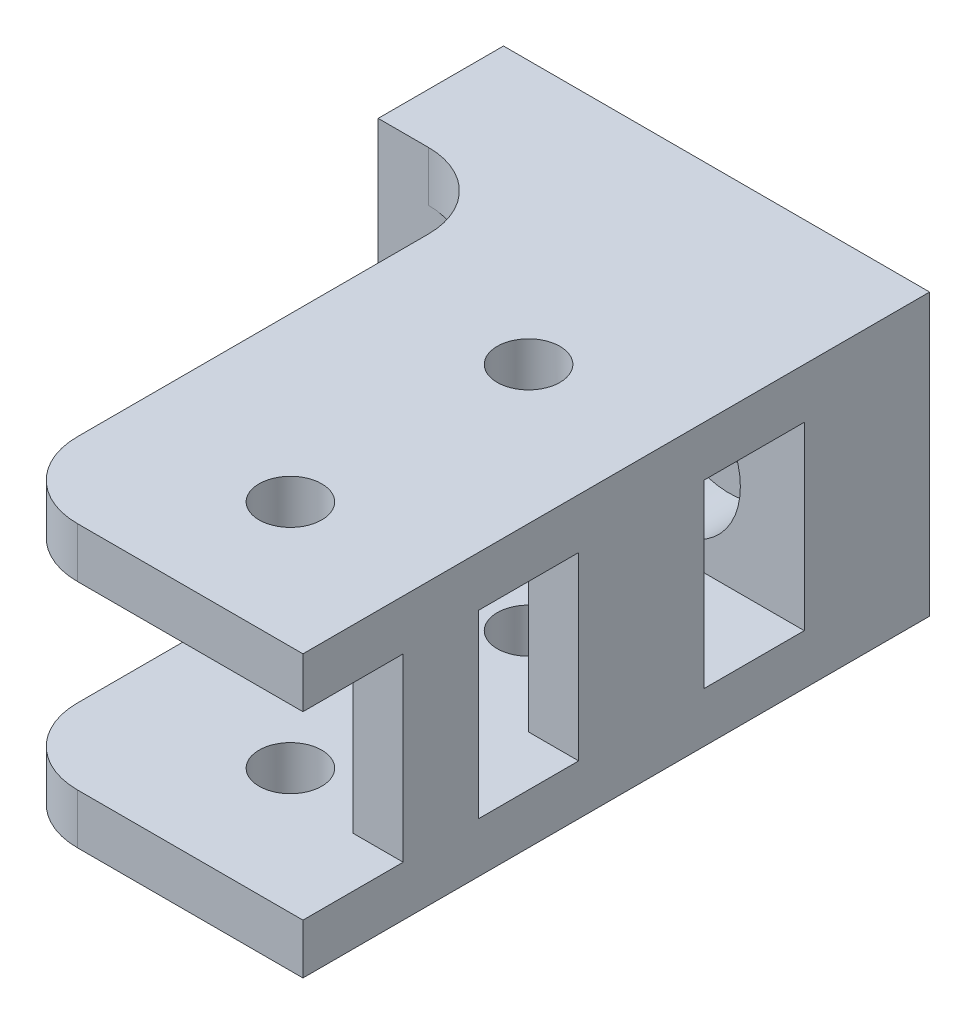
from build123d import *

# Parameters (mm, degrees)
ESQUISSE1_W             = 16.999166609
ESQUISSE1_H             = 11.2
ESQUISSE1_R             = 1.75
BOSS_EXTRU_1_DEPTH      = 5
ESQUISSE2_W             = 2
ESQUISSE2_H             = 7.2
BOSS_EXTRU_2_DEPTH      = 20
ESQUISSE3_W             = 4
ESQUISSE3_H             = 7.2
ENL_V_MAT_EXTRU_1_DEPTH = 20
ESQUISSE4_R             = 1.25
ESQUISSE4_W             = 4.999166609
ESQUISSE4_H             = 20
ENL_V_MAT_EXTRU_2_DEPTH = 20
ESQUISSE5_R             = 2.95
ENL_V_MAT_EXTRU_3_DEPTH = 2.5
CONG_1_START            = -11.2
CONG_1_DEPTH            = 12.2
CONG_1_2_DEPTH          = 2
CONG_1_START_2          = -2
CONG_1_3_DEPTH          = 2


with BuildPart() as part:
    # Esquisse1 → Boss.-Extru.1 (new body)
    with BuildSketch(Plane.XY):
        with Locations((8.499583304, -5.6)):
            Rectangle(ESQUISSE1_W, ESQUISSE1_H)
        with Locations((5.5, -5.6)):
            Circle(ESQUISSE1_R, mode=Mode.SUBTRACT)
        with Locations((11.499166609, -5.5)):
            Circle(ESQUISSE1_R, mode=Mode.SUBTRACT)
    extrude(amount=BOSS_EXTRU_1_DEPTH)

    # Esquisse2 → Boss.-Extru.2 (add)
    with BuildSketch(Plane.XY.offset(5)):
        Polygon((14.999166609, -9.2), (0, -9.2), (0, -11.2), (16.999166609, -11.2), (16.999166609, -9.2), align=None)
        with Locations((15.999166609, -5.6)):
            Rectangle(ESQUISSE2_W, ESQUISSE2_H)
        Polygon((16.999166609, 0), (0, 0), (0, -2), (14.999166609, -2), (16.999166609, -2), align=None)
    extrude(amount=BOSS_EXTRU_2_DEPTH)

    # Esquisse3 → Enlèv. mat.-Extru.1 (cut)
    with BuildSketch(Plane.ZY.offset(-14.999166609)):
        with Locations((7, -5.6)):
            Rectangle(ESQUISSE3_W, ESQUISSE3_H)
        with Locations((23, -5.6)):
            Rectangle(ESQUISSE3_W, ESQUISSE3_H)
        with Locations((16, -5.6)):
            Rectangle(ESQUISSE3_W, ESQUISSE3_H)
    extrude(amount=-ENL_V_MAT_EXTRU_1_DEPTH, mode=Mode.SUBTRACT)

    # Esquisse4 → Enlèv. mat.-Extru.2 (cut)
    with BuildSketch(Plane(origin=(0, -11.2, 0), x_dir=(-1, 0, 0), z_dir=(0, -1, 0))):
        with Locations(Location((-11.499166609, -20, 0), (0, 0, 90))):
            Circle(ESQUISSE4_R)
        with Locations(Location((-11.499166609, -10.5, 0), (0, 0, 90))):
            Circle(ESQUISSE4_R)
        with Locations((-2.499583305, -15)):
            Rectangle(ESQUISSE4_W, ESQUISSE4_H)
    extrude(amount=-ENL_V_MAT_EXTRU_2_DEPTH, mode=Mode.SUBTRACT)

    # Esquisse5 → Enlèv. mat.-Extru.3 (cut)
    with BuildSketch(Plane.XY.offset(5)):
        with Locations((5.5, -5.6)):
            Circle(ESQUISSE5_R)
        with Locations((11.499166609, -5.5)):
            Circle(ESQUISSE5_R)
    extrude(amount=-ENL_V_MAT_EXTRU_3_DEPTH, mode=Mode.SUBTRACT)

    # Congé1: read off the stored shape, not the designer's step
    # Congé1 outline → Congé1 (cut)
    with BuildSketch(Plane(origin=(0, 0, 0), x_dir=(1, 0, 0), z_dir=(0, 1, 0)).offset(CONG_1_START)):
        with BuildLine():
            ThreePointArc((7.999166609, -25), (5.877846265, -24.121320344), (4.999166609, -22))
            Line((4.999166609, -22), (4.999166609, -25))
            Line((4.999166609, -25), (7.999166609, -25))
        make_face()
    extrude(amount=CONG_1_DEPTH, mode=Mode.SUBTRACT)

    # Cong_1 2 outline → Cong_1 2 (add)
    with BuildSketch(Plane(origin=(0, 0, 0), x_dir=(1, 0, 0), z_dir=(0, 1, 0)).offset(CONG_1_START)):
        with BuildLine():
            ThreePointArc((1.999166609, -5), (4.120486952, -5.878679656), (4.999166609, -8))
            Line((4.999166609, -8), (4.999166609, -5))
            Line((4.999166609, -5), (1.999166609, -5))
        make_face()
    extrude(amount=CONG_1_2_DEPTH)

    # Cong_1 3 outline → Cong_1 3 (add)
    with BuildSketch(Plane(origin=(0, 0, 0), x_dir=(1, 0, 0), z_dir=(0, 1, 0)).offset(CONG_1_START_2)):
        with BuildLine():
            ThreePointArc((1.999166609, -5), (4.120486952, -5.878679656), (4.999166609, -8))
            Line((4.999166609, -8), (4.999166609, -5))
            Line((4.999166609, -5), (1.999166609, -5))
        make_face()
    extrude(amount=CONG_1_3_DEPTH)


solid = part.part
